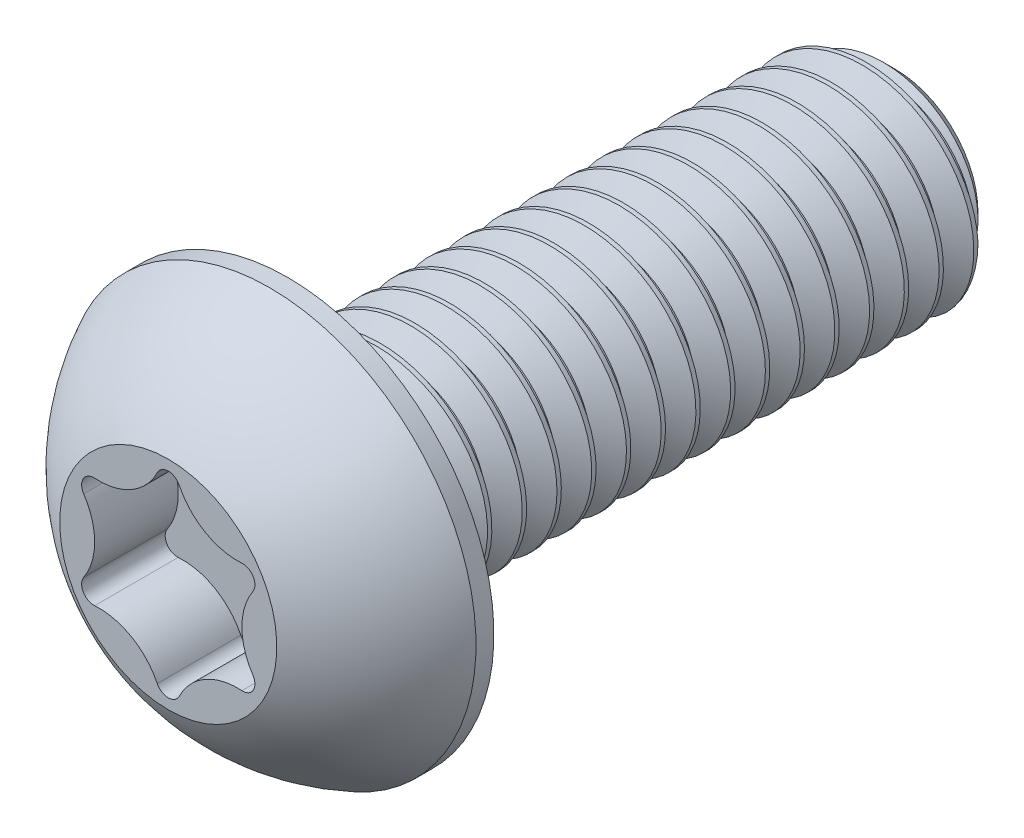
from build123d import *

# Parameters (mm, degrees)
SKETCH12_W         = 14
SKETCH12_H         = 2.5
CUT_EXTRUDE4_DEPTH = 1.925
CIRPATTERN1_COUNT  = 6
CHAMFER1_SIZE      = 0.6
CUT_SWEEP1_PITCH   = 0.8
CUT_SWEEP1_TO      = 14


with BuildPart() as part:
    # Sketch12 → Revolve1 (revolve)
    with BuildSketch(Plane(origin=(0, 0, 0), x_dir=(0, 0, -1), z_dir=(1, 0, 0))):
        with Locations((0, 1.25)):
            Rectangle(SKETCH12_W, SKETCH12_H)
    revolve(axis=Axis((0, 0, -7), (0, 0, 1)))

    # Sketch7 → Revolve2 (revolve)
    with BuildSketch(Plane(origin=(0, 0, 0), x_dir=(0, 0, -1), z_dir=(1, 0, 0)), mode=Mode.PRIVATE) as revolve2_sk:
        with BuildLine():
            Line((-7.4125, 4.75), (-7, 4.75))
            Line((-7, 4.75), (-7, 0))
            Line((-7, 0), (-9.75, 0))
            Line((-9.75, 0), (-9.75, 2.5))
            ThreePointArc((-9.75, 2.5), (-8.758124817, 3.808753282), (-7.4125, 4.75))
        make_face()
    revolve(revolve2_sk.sketch.rotate(Axis((0, 0, 9.75), (0, 0, -1)), 180), axis=Axis((0, 0, 9.75), (0, 0, -1)))

    # Sketch11 → Cut-Extrude4 (cut)
    with BuildSketch(Plane.XY.offset(9.75)):
        with BuildLine():
            Line((0, 0), (-1.957910233, 1.1304))
            ThreePointArc((-1.957910233, 1.1304), (-1.995619021, 0.979819267), (-1.948106604, 0.832038754))
            ThreePointArc((-1.948106604, 0.832038754), (-1.6956, 0), (-1.948106604, -0.832038754))
            ThreePointArc((-1.948106604, -0.832038754), (-1.995619021, -0.979819267), (-1.957910233, -1.1304))
            Line((-1.957910233, -1.1304), (0, 0))
        make_face()
    cut_extrude4 = extrude(amount=-CUT_EXTRUDE4_DEPTH, mode=Mode.SUBTRACT)

    # CirPattern1: Cut-Extrude4 ×6 about axis
    cirpattern1_axis = Axis((0, 0, 0), (0, 0, -1))
    for i in range(1, CIRPATTERN1_COUNT):
        add(cut_extrude4.rotate(cirpattern1_axis, i * 360 / CIRPATTERN1_COUNT), mode=Mode.SUBTRACT)

    # Chamfer1
    chamfer1_edges = [part.edges().sort_by_distance(p)[0] for p in [
        (0, -2.5, -7),
    ]]
    chamfer(chamfer1_edges, length=CHAMFER1_SIZE)


with BuildPart() as body_2:
    # Split1: read off the stored shape, not the designer's step
    # Split1: the piece on the far side of the plane
    add(part.part)
    split(bisect_by=Plane.XY.offset(7), keep=Keep.BOTTOM)

    # Cut-Sweep1: arcs per turn and ends read off the stored shape
    # Cut-Sweep1: the profile of Sketch14 screwed along a right-hand helix through 18.5 turns, 8 arcs to a turn; built about Z, then put on its axis
    cut_sweep1_z = Axis((0, 0, 0), (0, 0, 1))
    cut_sweep1_corners = [(1.980384758, 0, -0.3), (2.54330127, 0, 0.025), (2.54330127, 0, -0.725), (1.980384758, 0, -0.4)]
    with BuildLine(mode=Mode.PRIVATE) as cut_sweep1_profile:
        Line(cut_sweep1_corners[0], cut_sweep1_corners[1])
        Line(cut_sweep1_corners[1], cut_sweep1_corners[2])
        Line(cut_sweep1_corners[2], cut_sweep1_corners[3])
        Line(cut_sweep1_corners[3], cut_sweep1_corners[0])
    cut_sweep1_cap = Face(cut_sweep1_profile.wire())
    cut_sweep1_turn_angles = [0, 22.5, 45, 67.5, 90, 112.5, 135, 157.5, 180, 202.5, 225, 247.5, 270, 292.5, 315, 337.5, 360]
    cut_sweep1_turn_weights = [1, 0.9238795325112867, 1, 0.9238795325112867, 1, 0.9238795325112867, 1, 0.9238795325112867, 1, 0.9238795325112867, 1, 0.9238795325112867, 1, 0.9238795325112867, 1, 0.9238795325112867, 1]
    cut_sweep1_turn_rails = [Edge.make_bspline([Vector(p[0], p[1], 0).rotate(cut_sweep1_z, cut_sweep1_turn_angles[k]) / cut_sweep1_turn_weights[k] + Vector(0, 0, p[2] + CUT_SWEEP1_PITCH * cut_sweep1_turn_angles[k] / 360) for k in range(17)], [0, 0, 0, 1, 1, 2, 2, 3, 3, 4, 4, 5, 5, 6, 6, 7, 7, 8, 8, 8], 2, cut_sweep1_turn_weights) for p in cut_sweep1_corners]
    cut_sweep1_turn_sides = [Face.make_surface_from_curves(cut_sweep1_turn_rails[p[0]], cut_sweep1_turn_rails[p[1]]) for p in [(0, 1), (1, 2), (2, 3), (3, 0)]]
    cut_sweep1_last_angles = [6480, 6502.5, 6525, 6547.5, 6570, 6592.5, 6615, 6637.5, 6660]
    cut_sweep1_last_weights = [1, 0.9238795325112867, 1, 0.9238795325112867, 1, 0.9238795325112867, 1, 0.9238795325112533, 1]
    cut_sweep1_last_rails = [Edge.make_bspline([Vector(p[0], p[1], 0).rotate(cut_sweep1_z, cut_sweep1_last_angles[k]) / cut_sweep1_last_weights[k] + Vector(0, 0, p[2] + CUT_SWEEP1_PITCH * cut_sweep1_last_angles[k] / 360) for k in range(9)], [0, 0, 0, 1, 1, 2, 2, 3, 3, 4, 4, 4], 2, cut_sweep1_last_weights) for p in cut_sweep1_corners]
    cut_sweep1_last_sides = [Face.make_surface_from_curves(cut_sweep1_last_rails[p[0]], cut_sweep1_last_rails[p[1]]) for p in [(0, 1), (1, 2), (2, 3), (3, 0)]]
    cut_sweep1 = Plane(origin=(0, 0, -7), x_dir=(0, 1, 0), z_dir=(0, 0, 1)) * split(Solid(Shell([*[p.moved(Location((0, 0, CUT_SWEEP1_PITCH * i))) for i in range(18) for p in cut_sweep1_turn_sides], *cut_sweep1_last_sides, cut_sweep1_cap, cut_sweep1_cap.rotate(cut_sweep1_z, 6660).moved(Location((0, 0, CUT_SWEEP1_PITCH * 6660 / 360)))])), bisect_by=Plane.XY.offset(CUT_SWEEP1_TO), keep=Keep.BOTTOM, mode=Mode.PRIVATE)
    add(cut_sweep1, mode=Mode.SUBTRACT)


with BuildPart() as part_1:
    add(part.part)

    # Split1
    split(bisect_by=Plane.XY.offset(7), keep=Keep.TOP)

    # Combine1: union body 2
    add(body_2.part)


solid = part_1.part
